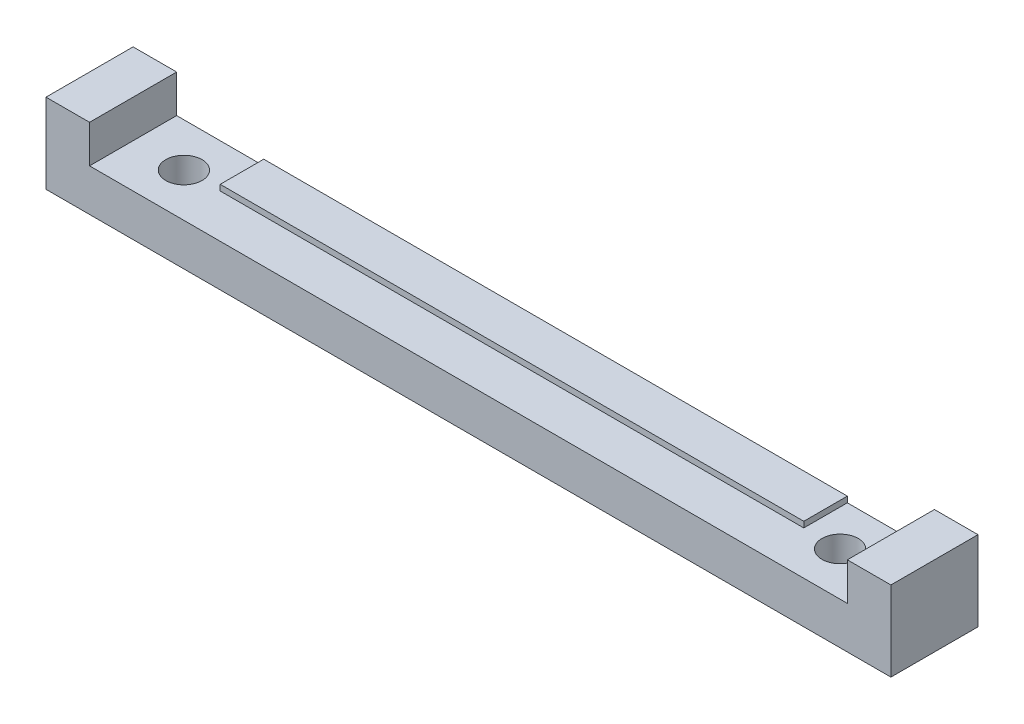
from build123d import *

# Parameters (mm, degrees)
BOSS_EXTRUDE1_DEPTH = 6
CUT_EXTRUDE3_REACH  = 60.766
SKETCH4_R           = 1.25
SKETCH5_W           = 40.2
SKETCH5_H           = 3
BOSS_EXTRUDE2_DEPTH = 0.4


with BuildPart() as part:
    # Sketch1 → Boss-Extrude1 (new body)
    with BuildSketch(Plane.XY):
        Polygon((0, 5.5), (0, 0), (58.2, 0), (58.2, 5.5), (55.2, 5.5), (55.2, 2.9), (3, 2.9), (3, 5.5), align=None)
    extrude(amount=BOSS_EXTRUDE1_DEPTH)

    # Sketch4 → Cut-Extrude3 (cut, up to next)
    with BuildSketch(Plane(origin=(0, 5.5, 0), x_dir=(1, 0, 0), z_dir=(0, 1, 0)), mode=Mode.PRIVATE) as cut_extrude3_sk1:
        with Locations((6.5, -3)):
            Circle(SKETCH4_R)
    cut_extrude3_tool1 = extrude(cut_extrude3_sk1.sketch, amount=-CUT_EXTRUDE3_REACH, mode=Mode.PRIVATE) & part.part
    # Sketch4 → Cut-Extrude3 (cut, up to next)
    with BuildSketch(Plane(origin=(0, 5.5, 0), x_dir=(1, 0, 0), z_dir=(0, 1, 0)), mode=Mode.PRIVATE) as cut_extrude3_sk2:
        with Locations((51.7, -3)):
            Circle(SKETCH4_R)
    cut_extrude3_tool2 = extrude(cut_extrude3_sk2.sketch, amount=-CUT_EXTRUDE3_REACH, mode=Mode.PRIVATE) & part.part
    add(cut_extrude3_tool1.solids().sort_by_distance((6.5, 5.5, 3))[0], mode=Mode.SUBTRACT)
    add(cut_extrude3_tool2.solids().sort_by_distance((51.7, 5.5, 3))[0], mode=Mode.SUBTRACT)

    # Sketch5 → Boss-Extrude2 (add)
    with BuildSketch(Plane(origin=(0, 2.9, 0), x_dir=(1, 0, 0), z_dir=(0, 1, 0))):
        with Locations((29.1, -1.5)):
            Rectangle(SKETCH5_W, SKETCH5_H)
    extrude(amount=BOSS_EXTRUDE2_DEPTH)


solid = part.part
